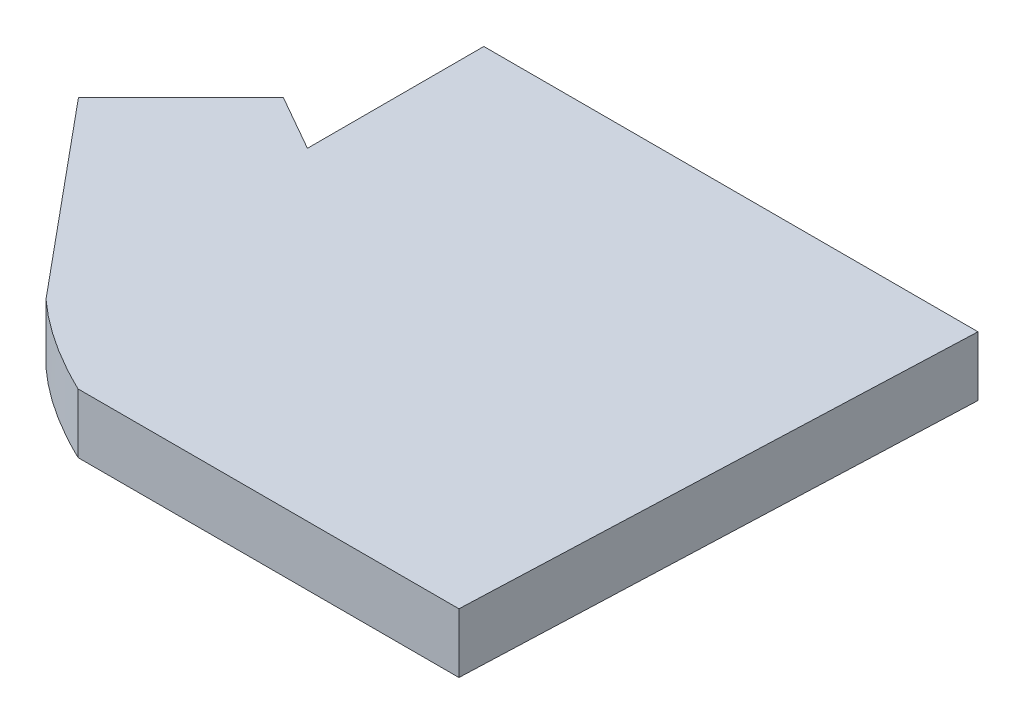
from build123d import *

# Parameters (mm, degrees)
BOSS_EXTRUDE1_DEPTH      = 5
BOSS_EXTRUDE1_DEPTH_BACK = 5


with BuildPart() as part:
    # Sketch1 → Boss-Extrude1 (new, two sides: drawn at the far end of the back side and taken through both)
    with BuildSketch(Plane(origin=(0, 0, 0), x_dir=(1, 0, 0), z_dir=(0, 1, 0)).offset(-BOSS_EXTRUDE1_DEPTH_BACK)):
        with BuildLine():
            Line((-13.928487002, -6.6), (69.071512998, -6.6))
            Line((69.071512998, -6.6), (65.775815813, -90.485447194))
            Line((65.775815813, -90.485447194), (1.805682841, -90.485447194))
            add(Edge.make_bspline(
                [(-13.928487002, -80.137896099), (-7.522602167, -85.991642169), (1.805682841, -90.485447194)],
                knots=[0, 0, 0, 1, 1, 1], degree=2))
            Line((-13.928487002, -80.137896099), (-40.559490947, -48.052901374))
            Line((-40.559490947, -48.052901374), (-23.359400971, -30.852811399))
            Line((-23.359400971, -30.852811399), (-13.928487002, -36.229878556))
            Line((-13.928487002, -36.229878556), (-13.928487002, -6.6))
        make_face()
    extrude(amount=BOSS_EXTRUDE1_DEPTH + BOSS_EXTRUDE1_DEPTH_BACK)


solid = part.part
